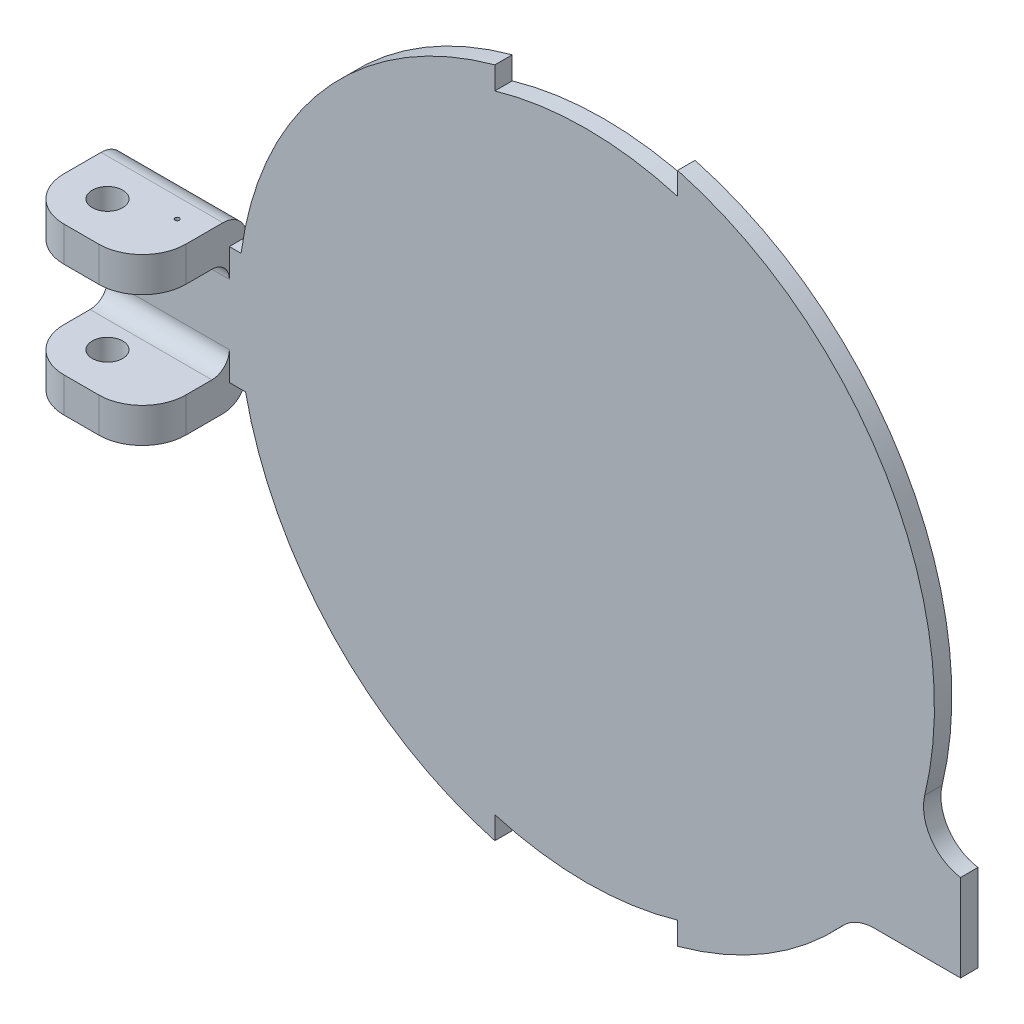
from build123d import *

# Parameters (mm, degrees)
SKETCH1_R                  = 1.7500000000000038
SKETCH1_R_2                = 1.7500000000000033
BASE_FLANGE1_DEPTH         = 2
SKETCHED_START             = -55
SKETCHED_BEND1_DEPTH       = 14
SKETCHED_START_2           = -48.2499999
SKETCHED_BEND1_2_DEPTH     = 7.2499999
SKETCHED_BEND1_3_DEPTH     = 3.2499999
SKETCHED_START_3           = -51.7500001
SKETCHED_BEND1_4_DEPTH     = 3.5000002
SKETCHED_START_4           = -10.9966
SKETCHED_BEND1_5_OUTLINE_R = 1.75
SKETCHED_BEND1_5_DEPTH     = 19.0032
FILLET1_R                  = 5
CUT_EXTRUDE2_REACH         = 70.738
FILLET2_R                  = 5
BOSS_EXTRUDE1_START        = 2
SKETCH9_R                  = 1.7500000000000036
BOSS_EXTRUDE1_DEPTH        = 2
CUT_EXTRUDE1_REACH         = 72.286
SKETCH7_R                  = 0.24999999999999958
SKETCH10_R                 = 1.7500000000000036
BOSS_EXTRUDE2_DEPTH        = 2
FILLET3_R                  = 2


with BuildPart() as part:
    # Base-Flange1: sheet metal written as solids
    # Sketch1 → Base-Flange1 (new body)
    with BuildSketch(Plane.XY):
        with BuildLine():
            Line((-39.65131901967449, 5.269999999999999), (-40.999999999999986, 5.270000000000006))
            Line((-40.999999999999986, 5.270000000000006), (-40.999999999999986, 17.26000000000001))
            Line((-40.999999999999986, 17.26000000000001), (-54.999999999999986, 17.260000000000012))
            Line((-54.999999999999986, 17.260000000000012), (-54.99999999999998, -20.25))
            Line((-54.99999999999998, -20.25), (-40.99999999999998, -20.250000000000004))
            Line((-40.99999999999998, -20.250000000000004), (-40.999999999999986, -8.26))
            Line((-40.999999999999986, -8.26), (-39.13786401938665, -8.26))
            ThreePointArc((-39.13786401938665, -8.26), (-9.571278660785763, -38.83800490238379), (30.81801421246995, -25.500000000000004))
            Line((30.81801421246995, -25.500000000000004), (43, -25.5))
            Line((43, -25.5), (43, -15.499999999999998))
            Line((43, -15.499999999999998), (36.874788134984584, -15.499999999999996))
            ThreePointArc((36.874788134984584, -15.499999999999996), (10.47738068118216, 38.60342593684647), (-39.65131901967449, 5.269999999999999))
        make_face()
        with Locations((-50, 12.260000000000014)):
            Circle(SKETCH1_R, mode=Mode.SUBTRACT)
        with Locations(Location((-49.999999999999986, -15.250000000000002, 0), (0, 0, 180))):
            Circle(SKETCH1_R_2, mode=Mode.SUBTRACT)
    extrude(amount=-BASE_FLANGE1_DEPTH)

    # Sketched Bend1: read off the stored shape, not the designer's step
    # Sketched Bend1 outline → Sketched Bend1 (cut)
    with BuildSketch(Plane.YZ.offset(SKETCHED_START)):
        with BuildLine():
            Line((-20.25, -2), (-8.26, -2))
            ThreePointArc((-8.26, -2), (-9.914267209, -1.443395312), (-10.895602398, 0))
            Line((-10.895602398, 0), (-20.25, 0))
            Line((-20.25, 0), (-20.25, -2))
        make_face()
        with BuildLine():
            ThreePointArc((7.905602398, 0), (6.924267209, -1.443395312), (5.27, -2))
            Line((5.27, -2), (17.26, -2))
            Line((17.26, -2), (17.26, 0))
            Line((17.26, 0), (7.905602398, 0))
        make_face()
    extrude(amount=SKETCHED_BEND1_DEPTH, mode=Mode.SUBTRACT)

    # Sketched Bend1 2 outline → Sketched Bend1 2 (add)
    with BuildSketch(Plane.YZ.offset(SKETCHED_START_2)):
        with BuildLine():
            ThreePointArc((-10.9966, 0.7366), (-10.971233029, 0.364854094), (-10.895602398, 0))
            Line((-10.895602398, 0), (-8.26, 0))
            ThreePointArc((-8.26, 0), (-8.780854855, 0.215745145), (-8.9966, 0.7366))
            Line((-8.9966, 0.7366), (-8.9966, 9.998755099))
            Line((-8.9966, 9.998755099), (-10.9966, 9.998755099))
            Line((-10.9966, 9.998755099), (-10.9966, 0.7366))
        make_face()
        with BuildLine():
            Line((5.27, 0), (7.905602398, 0))
            ThreePointArc((7.905602398, 0), (7.981233029, 0.364854094), (8.0066, 0.7366))
            Line((8.0066, 0.7366), (8.0066, 9.998755099))
            Line((8.0066, 9.998755099), (6.0066, 9.998755099))
            Line((6.0066, 9.998755099), (6.0066, 0.7366))
            ThreePointArc((6.0066, 0.7366), (5.790854855, 0.215745145), (5.27, 0))
        make_face()
    extrude(amount=SKETCHED_BEND1_2_DEPTH)

    # Sketched Bend1 3 outline → Sketched Bend1 3 (add)
    with BuildSketch(Plane.YZ.offset(SKETCHED_START)):
        with BuildLine():
            ThreePointArc((-10.9966, 0.7366), (-10.971233029, 0.364854094), (-10.895602398, 0))
            Line((-10.895602398, 0), (-8.26, 0))
            ThreePointArc((-8.26, 0), (-8.780854855, 0.215745145), (-8.9966, 0.7366))
            Line((-8.9966, 0.7366), (-8.9966, 9.998755099))
            Line((-8.9966, 9.998755099), (-10.9966, 9.998755099))
            Line((-10.9966, 9.998755099), (-10.9966, 0.7366))
        make_face()
        with BuildLine():
            Line((5.27, 0), (7.905602398, 0))
            ThreePointArc((7.905602398, 0), (7.981233029, 0.364854094), (8.0066, 0.7366))
            Line((8.0066, 0.7366), (8.0066, 9.998755099))
            Line((8.0066, 9.998755099), (6.0066, 9.998755099))
            Line((6.0066, 9.998755099), (6.0066, 0.7366))
            ThreePointArc((6.0066, 0.7366), (5.790854855, 0.215745145), (5.27, 0))
        make_face()
    extrude(amount=SKETCHED_BEND1_3_DEPTH)

    # Sketched Bend1 4 outline → Sketched Bend1 4 (add)
    with BuildSketch(Plane.YZ.offset(SKETCHED_START_3)):
        with BuildLine():
            ThreePointArc((6.0066, 0.7366), (5.790854855, 0.215745145), (5.27, 0))
            Line((5.27, 0), (7.905602398, 0))
            ThreePointArc((7.905602398, 0), (7.981233029, 0.364854094), (8.0066, 0.7366))
            Line((8.0066, 0.7366), (8.0066, 9.998755099))
            Line((8.0066, 9.998755099), (6.0066, 9.998755099))
            Line((6.0066, 9.998755099), (6.0066, 0.7366))
        make_face()
        with BuildLine():
            ThreePointArc((-10.9966, 0.7366), (-10.971233029, 0.364854094), (-10.895602398, 0))
            Line((-10.895602398, 0), (-8.26, 0))
            ThreePointArc((-8.26, 0), (-8.780854855, 0.215745145), (-8.9966, 0.7366))
            Line((-8.9966, 0.7366), (-8.9966, 9.998755099))
            Line((-8.9966, 9.998755099), (-10.9966, 9.998755099))
            Line((-10.9966, 9.998755099), (-10.9966, 0.7366))
        make_face()
    extrude(amount=SKETCHED_BEND1_4_DEPTH)

    # Sketched Bend1 5 outline → Sketched Bend1 5 (cut)
    with BuildSketch(Plane(origin=(0, 0, 0), x_dir=(1, 0, 0), z_dir=(0, 1, 0)).offset(SKETCHED_START_4)):
        with Locations((-50, -4.998755099)):
            Circle(SKETCHED_BEND1_5_OUTLINE_R)
    extrude(amount=SKETCHED_BEND1_5_DEPTH, mode=Mode.SUBTRACT)

    # Fillet1
    # the kernel refuses this fillet: 5 mm, written as the material it adds along each edge
    with BuildSketch(Plane(origin=(30.818014212469954, -25.500000000000007, 0), x_dir=(-0.6578741358493351, -0.7531278917823256, 0), z_dir=(0, 0, -1))) as fillet1_piece_1:
        with BuildLine():
            CenterArc((2.272928109865178, -4.998212067114161), FILLET1_R, 91.53229073869478, 47.329766128742406)
            Line((-1.49271134904645, -1.7088413878674857), (-1.5680241382246838, -1.6430539742825514))
            Line((-1.5680241382246838, -1.6430539742825514), (-0.07531278917823364, 0.06578741358493444))
            Line((-0.07531278917823364, 0.06578741358493444), (0.00267403307043032, 0.09996424134228217))
            ThreePointArc((0.00267403307043032, 0.09996424134228217), (1.0696132281718547, 0.0856965369132901), (2.1365524232732724, 0.0999642413422845))
            Line((2.1365524232732724, 0.0999642413422845), (2.139226456343701, -1e-16))
        make_face()
    extrude(amount=2)
    with BuildSketch(Plane(origin=(36.874788134984584, -15.499999999999996, 0), x_dir=(0.3120481831654017, 0.9500662773634121, 0), z_dir=(0, 0, -1))) as fillet1_piece_2:
        with BuildLine():
            CenterArc((6.841047896129056, 4.983779941379127), FILLET1_R, 170.3798521279212, 95.00382355421686)
            Line((1.911361233981272, 5.8193572346573905), (1.8127675007383173, 5.836068780522958))
            ThreePointArc((1.8127675007383173, 5.836068780522958), (0.8606739892542704, 2.9408834356452394), (-0.09500662773634087, 0.03120481831654006))
            Line((-0.09500662773634087, 0.03120481831654006), (0.00804829164250585, -0.09967559882757966))
            ThreePointArc((0.00804829164250585, -0.09967559882757966), (3.219316657001906, 0.02976046896695109), (6.430585022361307, -0.09967559882758435))
            Line((6.430585022361307, -0.09967559882758435), (6.438633314003813, 2.9e-16))
        make_face()
    extrude(amount=2)

    # Sketch8 → Cut-Extrude2 (cut, up to next)
    with BuildSketch(Plane.XY, mode=Mode.PRIVATE) as cut_extrude2_sk1:
        with BuildLine():
            Line((10.500000000000004, -38.59727969689056), (10.50000000000001, -36))
            ThreePointArc((10.500000000000012, -36), (4.4e-16, -37.5), (-10.50000000000001, -36))
            Line((-10.50000000000001, -36), (-10.499999999999996, -38.59727969689056))
            ThreePointArc((-10.499999999999998, -38.59727969689057), (2.22e-15, -40.00000000000001), (10.499999999999998, -38.59727969689057))
        make_face()
    cut_extrude2_tool1 = extrude(cut_extrude2_sk1.sketch, amount=-CUT_EXTRUDE2_REACH, mode=Mode.PRIVATE) & part.part
    # Sketch8 → Cut-Extrude2 (cut, up to next)
    with BuildSketch(Plane.XY, mode=Mode.PRIVATE) as cut_extrude2_sk2:
        with BuildLine():
            ThreePointArc((10.5, 35.99999999999999), (2.3e-15, 37.49999999999999), (-10.5, 35.99999999999999))
            Line((-10.5, 35.99999999999999), (-10.500000000000004, 38.59727969689055))
            ThreePointArc((-10.500000000000004, 38.59727969689055), (2.45e-15, 39.99999999999999), (10.499999999999996, 38.59727969689055))
            Line((10.499999999999996, 38.59727969689055), (10.5, 35.99999999999999))
        make_face()
    cut_extrude2_tool2 = extrude(cut_extrude2_sk2.sketch, amount=-CUT_EXTRUDE2_REACH, mode=Mode.PRIVATE) & part.part
    add(cut_extrude2_tool1.solids().sort_by_distance((0, -38.265011, 0))[0], mode=Mode.SUBTRACT)
    add(cut_extrude2_tool2.solids().sort_by_distance((0, 38.265011, 0))[0], mode=Mode.SUBTRACT)

    # Fillet2
    fillet2_edges = [part.edges().sort_by_distance(p)[0] for p in [
        (-55, 7.006600000000001, 9.998755099),
        (-41, 7.006600000000001, 9.998755099),
        (-41, -9.9966, 9.998755099),
        (-55, -9.9966, 9.998755099),
    ]]
    fillet(fillet2_edges, radius=FILLET2_R)

    # Sketch9 → Boss-Extrude1 (add)
    with BuildSketch(Plane.XZ.offset(-6.006600000000028).offset(BOSS_EXTRUDE1_START)):
        with BuildLine():
            Line((-54.999999999999986, 0.7365999999999726), (-54.999999999999986, -1.843e-14))
            Line((-54.999999999999986, -1.843e-14), (-40.999999999999986, -1.843e-14))
            Line((-40.999999999999986, -1.843e-14), (-40.999999999999986, 0.7365999999999743))
            Line((-40.999999999999986, 0.7365999999999743), (-40.999999999999986, 4.998755098887944))
            ThreePointArc((-40.999999999999986, 4.998755098887944), (-42.46446609406725, 8.534289004820682), (-45.999999999999986, 9.998755098887946))
            Line((-45.999999999999986, 9.998755098887946), (-49.999999999999986, 9.998755098887948))
            ThreePointArc((-49.999999999999986, 9.998755098887948), (-53.53553390593273, 8.53428900482069), (-54.999999999999986, 4.99875509888795))
            Line((-54.999999999999986, 4.99875509888795), (-54.999999999999986, 0.7365999999999726))
        make_face()
        with Locations(Location((-50, 4.998755098887954, 0), (0, 0, 180))):
            Circle(SKETCH9_R, mode=Mode.SUBTRACT)
    extrude(amount=-BOSS_EXTRUDE1_DEPTH)

    # Sketch7 → Cut-Extrude1 (cut, up to next)
    with BuildSketch(Plane.XZ.offset(-4.006600000000027), mode=Mode.PRIVATE) as cut_extrude1_sk1:
        with Locations(Location((-44.00000000000001, 2.998755098887952, 0), (0, 0, 270))):
            Circle(SKETCH7_R)
    cut_extrude1_tool1 = extrude(cut_extrude1_sk1.sketch, amount=-CUT_EXTRUDE1_REACH, mode=Mode.PRIVATE) & part.part
    add(cut_extrude1_tool1.solids().sort_by_distance((-44, 4.0066, 2.998755))[0], mode=Mode.SUBTRACT)

    # Sketch10 → Boss-Extrude2 (add)
    with BuildSketch(Plane(origin=(0, -8.996599999999987, 3.141e-14), x_dir=(1, 0, 0), z_dir=(0, 1, -3.49e-15))):
        with BuildLine():
            Line((-54.99999999999998, 2.884e-14), (-54.99999999999998, -0.7365999999999777))
            Line((-54.99999999999998, -0.7365999999999777), (-54.99999999999998, -4.99875509888795))
            ThreePointArc((-54.99999999999998, -4.99875509888795), (-53.535533905932716, -8.534289004820696), (-49.99999999999997, -9.998755098887964))
            Line((-49.99999999999997, -9.998755098887964), (-45.99999999999998, -9.998755098887965))
            ThreePointArc((-45.99999999999998, -9.998755098887965), (-42.46446609406724, -8.534289004820701), (-40.99999999999998, -4.998755098887962))
            Line((-40.99999999999998, -4.998755098887962), (-40.999999999999986, -0.7365999999999864))
            Line((-40.999999999999986, -0.7365999999999864), (-40.999999999999986, 2.884e-14))
            Line((-40.999999999999986, 2.884e-14), (-54.99999999999998, 2.884e-14))
        make_face()
        with Locations(Location((-49.999999999999986, -4.9987550988879645, 0), (0, 0, 270))):
            Circle(SKETCH10_R, mode=Mode.SUBTRACT)
    extrude(amount=BOSS_EXTRUDE2_DEPTH)

    # Fillet3
    fillet3_edges = [part.edges().sort_by_distance(p)[0] for p in [
        (-47.999999999999986, 4.006600000000022, -4.44e-15),
        (-47.999999999999986, -6.996599999999987, -4.41e-15),
    ]]
    fillet(fillet3_edges, radius=FILLET3_R)


solid = part.part
